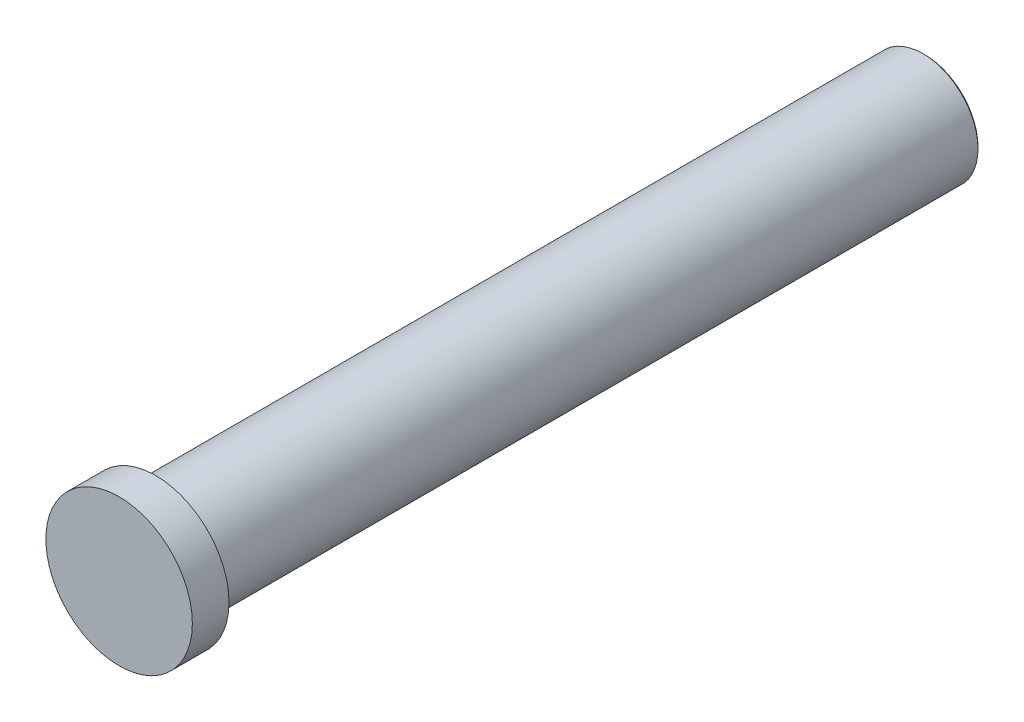
from build123d import *

# Parameters (mm, degrees)
SKETCH2_R           = 1.5
BOSS_EXTRUDE1_DEPTH = 21
CHAMFER2_SIZE       = 0.05
SKETCH3_R           = 2
BOSS_EXTRUDE2_DEPTH = 1


with BuildPart() as part:
    # Sketch2 → Boss-Extrude1 (new body)
    with BuildSketch(Plane.XY):
        Circle(SKETCH2_R)
    extrude(amount=BOSS_EXTRUDE1_DEPTH)

    # Chamfer2
    chamfer2_edges = [part.edges().sort_by_distance(p)[0] for p in [
        (-1.5, 0, 21),
        (-1.5, 0, 0),
    ]]
    chamfer(chamfer2_edges, length=CHAMFER2_SIZE)

    # Sketch3 → Boss-Extrude2 (add)
    with BuildSketch(Plane.XY.offset(21)):
        Circle(SKETCH3_R)
    extrude(amount=BOSS_EXTRUDE2_DEPTH)


solid = part.part
